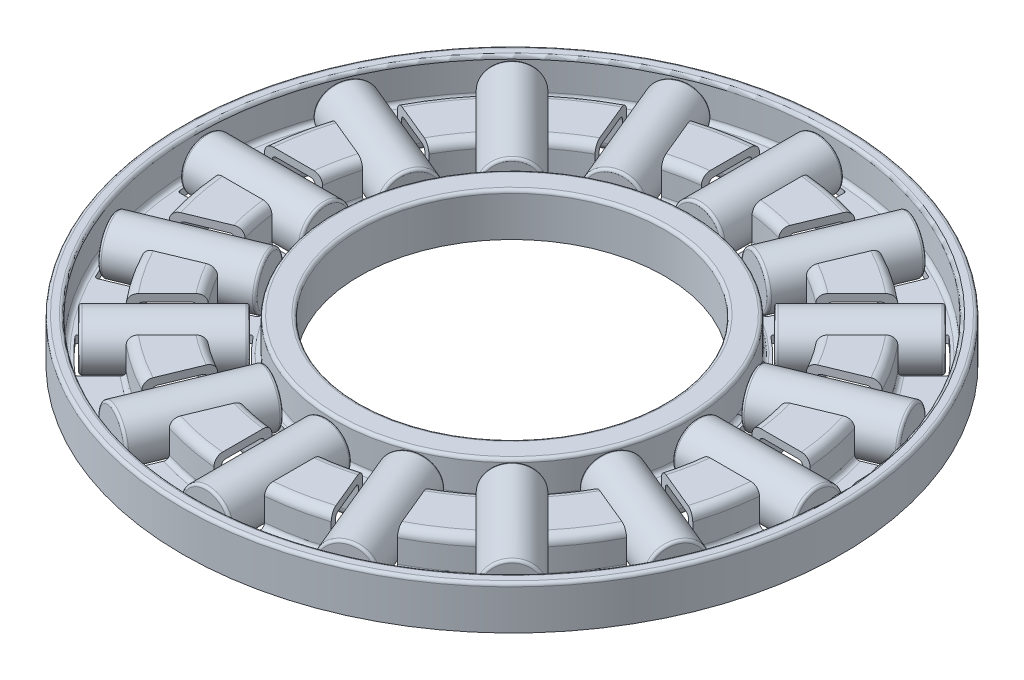
from build123d import *

# Parameters (mm, degrees)
FILLET1_R                = 0.338461538
FILLET2_R                = 0.338461538
FILLET3_R                = 0.125
FILLET4_R                = 0.169230769
CUT_EXTRUDE1_DEPTH       = 19.404415231
FILLET5_R                = 0.100111857
CIRPATTERN1_COUNT        = 16
FILLET5_OF_CIRPATTERN1_R = 0.100111857
SKETCH5_W                = 4.771442755
SKETCH5_H                = 1
FILLET6_R                = 0.100111857
CIRPATTERN2_COUNT        = 16


with BuildPart() as part:
    # Sketch3 → Revolve1 (revolve)
    with BuildSketch(Plane(origin=(0, 0, 0), x_dir=(0, 0, -1), z_dir=(1, 0, 0))):
        Polygon((6.344, -0.85), (6.344, 0.557794872), (6.672, 0.557794872), (6.672, -0.85), (8.823179487, -0.85), (8.823179487, 0.557794872), (10.515487179, 0.557794872), (10.515487179, -0.85), (12.666666667, -0.85), (12.666666667, 0.557794872), (12.833333333, 0.557794872), (12.833333333, -0.85), (13, -0.85), (13, 0.85), (12.5, 0.85), (12.5, -0.557794872), (10.807692308, -0.557794872), (10.807692308, 0.85), (8.530974359, 0.85), (8.530974359, -0.557794872), (7, -0.557794872), (7, 0.85), (6.016, 0.85), (6.016, -0.85), align=None)
    revolve(axis=Axis((0, 1, 0), (0, -1, 0)))

    # Fillet1
    fillet1_edges = [part.edges().sort_by_distance(p)[0] for p in [
        (0, -0.85, 10.515487179),
        (0, -0.85, 12.666666667),
        (0, -0.85, 6.672),
        (0, -0.85, 8.823179487),
    ]]
    fillet(fillet1_edges, radius=FILLET1_R)

    # Fillet2
    fillet2_edges = [part.edges().sort_by_distance(p)[0] for p in [
        (0, 0.85, 10.807692308),
        (0, 0.85, 8.530974359),
    ]]
    fillet(fillet2_edges, radius=FILLET2_R)

    # Fillet3
    fillet3_edges = [part.edges().sort_by_distance(p)[0] for p in [
        (0, 0.85, 12.5),
        (0, 0.85, 13),
        (0, 0.85, 7),
        (0, 0.85, 6.016),
    ]]
    fillet(fillet3_edges, radius=FILLET3_R)

    # Fillet4
    fillet4_edges = [part.edges().sort_by_distance(p)[0] for p in [
        (0, 0.557794872, 8.823179487),
        (0, 0.557794872, 10.515487179),
        (0, -0.557794872, 12.5),
        (0, -0.557794872, 10.807692308),
        (0, -0.557794872, 8.530974359),
        (0, -0.557794872, 7),
    ]]
    fillet(fillet4_edges, radius=FILLET4_R)

    # Sketch4 → Cut-Extrude1 (cut, symmetric)
    with BuildSketch(Plane(origin=(0, 0, 0), x_dir=(1, 0, 0), z_dir=(0, 1, 0))):
        with BuildLine():
            Line((7.205943727, 1), (12.184031558, 1))
            ThreePointArc((12.184031558, 1), (12.225, 0), (12.184031558, -1))
            Line((12.184031558, -1), (7.205943727, -1))
            ThreePointArc((7.205943727, -1), (7.275, 0), (7.205943727, 1))
        make_face()
    cut_extrude1 = extrude(amount=CUT_EXTRUDE1_DEPTH, both=True, mode=Mode.SUBTRACT)

    # Fillet5
    fillet5_edges = [part.edges().sort_by_distance(p)[0] for p in [
        (12.184031558, -0.703897436, -1),
        (12.184031558, -0.703897436, 1),
        (7.205943727, -0.703897436, -1),
        (7.205943727, -0.703897436, 1),
    ]]
    fillet(fillet5_edges, radius=FILLET5_R)

    # CirPattern1: Cut-Extrude1 ×16 about axis
    cirpattern1_axis = Axis((0, 1, 0), (0, -1, 0))
    for i in range(1, CIRPATTERN1_COUNT):
        add(cut_extrude1.rotate(cirpattern1_axis, i * 360 / CIRPATTERN1_COUNT), mode=Mode.SUBTRACT)

    # Fillet5 of CirPattern1
    fillet5_of_cirpattern1_edges = [part.edges().sort_by_distance(p)[0] for p in [
        (11.639260812, -0.703897436, 3.738747484),
        (10.873893947, -0.703897436, 5.586506549),
        (7.040107354, -0.703897436, 1.833715746),
        (6.27474049, -0.703897436, 3.681474811),
        (9.322518118, -0.703897436, 7.908304555),
        (7.908304555, -0.703897436, 9.322518118),
        (5.802478456, -0.703897436, 4.388264893),
        (4.388264893, -0.703897436, 5.802478456),
        (5.586506549, -0.703897436, 10.873893947),
        (3.738747484, -0.703897436, 11.639260812),
        (3.681474811, -0.703897436, 6.27474049),
        (1.833715746, -0.703897436, 7.040107354),
        (1, -0.703897436, 12.184031558),
        (-1, -0.703897436, 12.184031558),
        (1, -0.703897436, 7.205943727),
        (-1, -0.703897436, 7.205943727),
        (-3.738747484, -0.703897436, 11.639260812),
        (-5.586506549, -0.703897436, 10.873893947),
        (-1.833715746, -0.703897436, 7.040107354),
        (-3.681474811, -0.703897436, 6.27474049),
        (-7.908304555, -0.703897436, 9.322518118),
        (-9.322518118, -0.703897436, 7.908304555),
        (-4.388264893, -0.703897436, 5.802478456),
        (-5.802478456, -0.703897436, 4.388264893),
        (-10.873893947, -0.703897436, 5.586506549),
        (-11.639260812, -0.703897436, 3.738747484),
        (-6.27474049, -0.703897436, 3.681474811),
        (-7.040107354, -0.703897436, 1.833715746),
        (-12.184031558, -0.703897436, 1),
        (-12.184031558, -0.703897436, -1),
        (-7.205943727, -0.703897436, 1),
        (-7.205943727, -0.703897436, -1),
        (-11.639260812, -0.703897436, -3.738747484),
        (-10.873893947, -0.703897436, -5.586506549),
        (-7.040107354, -0.703897436, -1.833715746),
        (-6.27474049, -0.703897436, -3.681474811),
        (-9.322518118, -0.703897436, -7.908304555),
        (-7.908304555, -0.703897436, -9.322518118),
        (-5.802478456, -0.703897436, -4.388264893),
        (-4.388264893, -0.703897436, -5.802478456),
        (-5.586506549, -0.703897436, -10.873893947),
        (-3.738747484, -0.703897436, -11.639260812),
        (-3.681474811, -0.703897436, -6.27474049),
        (-1.833715746, -0.703897436, -7.040107354),
        (-1, -0.703897436, -12.184031558),
        (1, -0.703897436, -12.184031558),
        (-1, -0.703897436, -7.205943727),
        (1, -0.703897436, -7.205943727),
        (3.738747484, -0.703897436, -11.639260812),
        (5.586506549, -0.703897436, -10.873893947),
        (1.833715746, -0.703897436, -7.040107354),
        (3.681474811, -0.703897436, -6.27474049),
        (7.908304555, -0.703897436, -9.322518118),
        (9.322518118, -0.703897436, -7.908304555),
        (4.388264893, -0.703897436, -5.802478456),
        (5.802478456, -0.703897436, -4.388264893),
        (10.873893947, -0.703897436, -5.586506549),
        (11.639260812, -0.703897436, -3.738747484),
        (6.27474049, -0.703897436, -3.681474811),
        (7.040107354, -0.703897436, -1.833715746),
    ]]
    fillet(fillet5_of_cirpattern1_edges, radius=FILLET5_OF_CIRPATTERN1_R)


with BuildPart() as body_2:
    # Sketch5 → Revolve2 (revolve)
    with BuildSketch(Plane(origin=(0, 0, 0), x_dir=(1, 0, 0), z_dir=(0, 1, 0))):
        with Locations((9.705726585, 0.5)):
            Rectangle(SKETCH5_W, SKETCH5_H)
    revolve(axis=Axis((12.225, 0, 0), (-1, 0, 0)))

    # Fillet6
    fillet6_edges = [body_2.edges().sort_by_distance(p)[0] for p in [
        (7.320005207, 0, 1),
        (12.091447962, 0, 1),
    ]]
    fillet(fillet6_edges, radius=FILLET6_R)


with BuildPart() as cirpattern2_1:
    # CirPattern2: pattern copy
    add(body_2.part.rotate(Axis((0, 1, 0), (0, -1, 0)), 1 * 360 / CIRPATTERN2_COUNT))


with BuildPart() as cirpattern2_2:
    # CirPattern2: pattern copy
    add(body_2.part.rotate(Axis((0, 1, 0), (0, -1, 0)), 2 * 360 / CIRPATTERN2_COUNT))


with BuildPart() as cirpattern2_3:
    # CirPattern2: pattern copy
    add(body_2.part.rotate(Axis((0, 1, 0), (0, -1, 0)), 3 * 360 / CIRPATTERN2_COUNT))


with BuildPart() as cirpattern2_4:
    # CirPattern2: pattern copy
    add(body_2.part.rotate(Axis((0, 1, 0), (0, -1, 0)), 4 * 360 / CIRPATTERN2_COUNT))


with BuildPart() as cirpattern2_5:
    # CirPattern2: pattern copy
    add(body_2.part.rotate(Axis((0, 1, 0), (0, -1, 0)), 5 * 360 / CIRPATTERN2_COUNT))


with BuildPart() as cirpattern2_6:
    # CirPattern2: pattern copy
    add(body_2.part.rotate(Axis((0, 1, 0), (0, -1, 0)), 6 * 360 / CIRPATTERN2_COUNT))


with BuildPart() as cirpattern2_7:
    # CirPattern2: pattern copy
    add(body_2.part.rotate(Axis((0, 1, 0), (0, -1, 0)), 7 * 360 / CIRPATTERN2_COUNT))


with BuildPart() as cirpattern2_8:
    # CirPattern2: pattern copy
    add(body_2.part.rotate(Axis((0, 1, 0), (0, -1, 0)), 8 * 360 / CIRPATTERN2_COUNT))


with BuildPart() as cirpattern2_9:
    # CirPattern2: pattern copy
    add(body_2.part.rotate(Axis((0, 1, 0), (0, -1, 0)), 9 * 360 / CIRPATTERN2_COUNT))


with BuildPart() as cirpattern2_10:
    # CirPattern2: pattern copy
    add(body_2.part.rotate(Axis((0, 1, 0), (0, -1, 0)), 10 * 360 / CIRPATTERN2_COUNT))


with BuildPart() as cirpattern2_11:
    # CirPattern2: pattern copy
    add(body_2.part.rotate(Axis((0, 1, 0), (0, -1, 0)), 11 * 360 / CIRPATTERN2_COUNT))


with BuildPart() as cirpattern2_12:
    # CirPattern2: pattern copy
    add(body_2.part.rotate(Axis((0, 1, 0), (0, -1, 0)), 12 * 360 / CIRPATTERN2_COUNT))


with BuildPart() as cirpattern2_13:
    # CirPattern2: pattern copy
    add(body_2.part.rotate(Axis((0, 1, 0), (0, -1, 0)), 13 * 360 / CIRPATTERN2_COUNT))


with BuildPart() as cirpattern2_14:
    # CirPattern2: pattern copy
    add(body_2.part.rotate(Axis((0, 1, 0), (0, -1, 0)), 14 * 360 / CIRPATTERN2_COUNT))


with BuildPart() as cirpattern2_15:
    # CirPattern2: pattern copy
    add(body_2.part.rotate(Axis((0, 1, 0), (0, -1, 0)), 15 * 360 / CIRPATTERN2_COUNT))


solid = Compound([part.part, body_2.part, cirpattern2_1.part, cirpattern2_2.part, cirpattern2_3.part, cirpattern2_4.part, cirpattern2_5.part, cirpattern2_6.part, cirpattern2_7.part, cirpattern2_8.part, cirpattern2_9.part, cirpattern2_10.part, cirpattern2_11.part, cirpattern2_12.part, cirpattern2_13.part, cirpattern2_14.part, cirpattern2_15.part])
